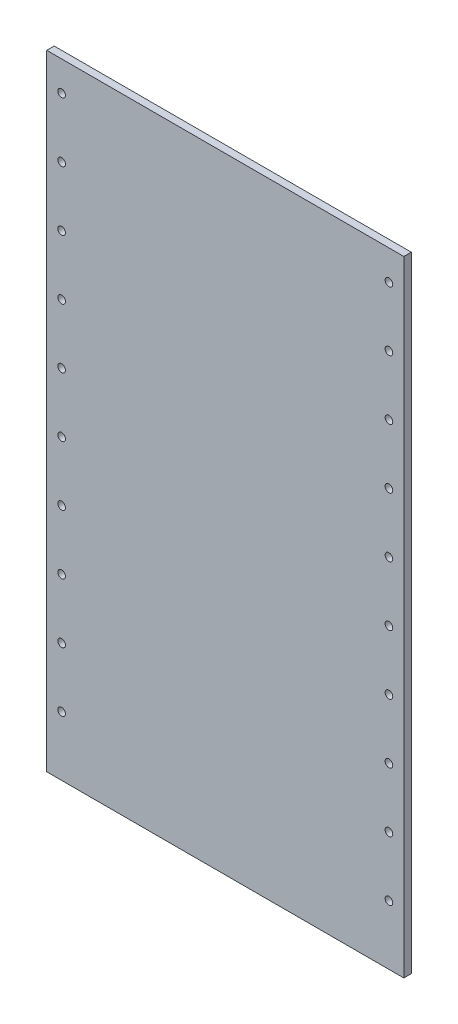
from build123d import *

# Parameters (mm, degrees)
SKETCH1_W           = 152.4
SKETCH1_H           = 266.7
SKETCH1_R           = 1.63195
BOSS_EXTRUDE1_DEPTH = 3.175


with BuildPart() as part:
    # Sketch1 → Boss-Extrude1 (new body)
    with BuildSketch(Plane.XY):
        with Locations((76.2, -133.35)):
            Rectangle(SKETCH1_W, SKETCH1_H)
        with Locations((6.35, -12.7)):
            Circle(SKETCH1_R, mode=Mode.SUBTRACT)
        with Locations((146.05, -12.7)):
            Circle(SKETCH1_R, mode=Mode.SUBTRACT)
        with Locations((146.05, -38.1)):
            Circle(SKETCH1_R, mode=Mode.SUBTRACT)
        with Locations((146.05, -63.5)):
            Circle(SKETCH1_R, mode=Mode.SUBTRACT)
        with Locations((146.05, -88.9)):
            Circle(SKETCH1_R, mode=Mode.SUBTRACT)
        with Locations((146.05, -114.3)):
            Circle(SKETCH1_R, mode=Mode.SUBTRACT)
        with Locations((146.05, -139.7)):
            Circle(SKETCH1_R, mode=Mode.SUBTRACT)
        with Locations((146.05, -165.1)):
            Circle(SKETCH1_R, mode=Mode.SUBTRACT)
        with Locations((146.05, -190.5)):
            Circle(SKETCH1_R, mode=Mode.SUBTRACT)
        with Locations((146.05, -215.9)):
            Circle(SKETCH1_R, mode=Mode.SUBTRACT)
        with Locations((146.05, -241.3)):
            Circle(SKETCH1_R, mode=Mode.SUBTRACT)
        with Locations((6.35, -38.1)):
            Circle(SKETCH1_R, mode=Mode.SUBTRACT)
        with Locations((6.35, -63.5)):
            Circle(SKETCH1_R, mode=Mode.SUBTRACT)
        with Locations((6.35, -88.9)):
            Circle(SKETCH1_R, mode=Mode.SUBTRACT)
        with Locations((6.35, -114.3)):
            Circle(SKETCH1_R, mode=Mode.SUBTRACT)
        with Locations((6.35, -139.7)):
            Circle(SKETCH1_R, mode=Mode.SUBTRACT)
        with Locations((6.35, -165.1)):
            Circle(SKETCH1_R, mode=Mode.SUBTRACT)
        with Locations((6.35, -190.5)):
            Circle(SKETCH1_R, mode=Mode.SUBTRACT)
        with Locations((6.35, -215.9)):
            Circle(SKETCH1_R, mode=Mode.SUBTRACT)
        with Locations((6.35, -241.3)):
            Circle(SKETCH1_R, mode=Mode.SUBTRACT)
    extrude(amount=BOSS_EXTRUDE1_DEPTH)


solid = part.part
